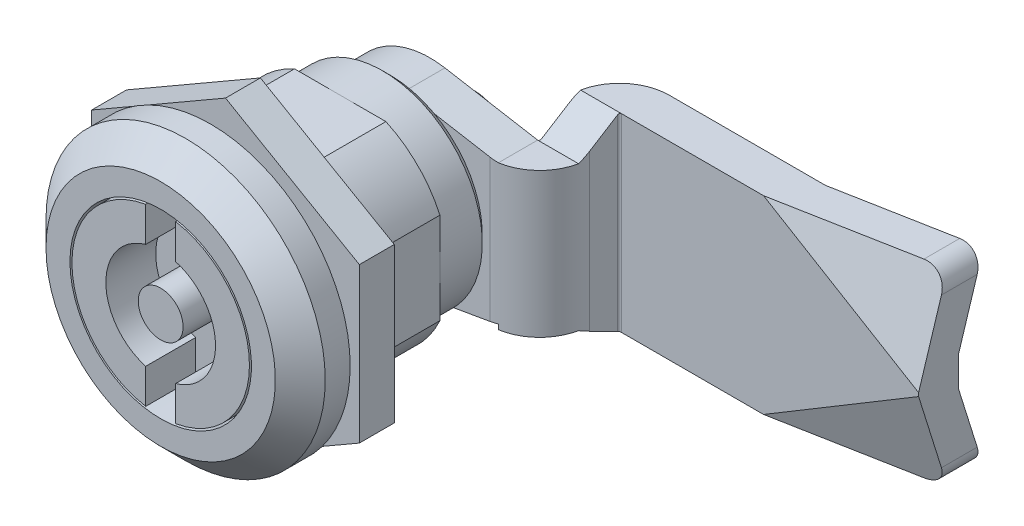
from build123d import *
from OCP.BRepFilletAPI import BRepFilletAPI_MakeChamfer

# Parameters (mm, degrees)
SKETCH1_R           = 14
EXTRUDE1_DEPTH      = 5
EXTRUDE2_DEPTH      = 18
SKETCH7_R           = 11.1
EXTRUDE6_DEPTH      = 3.5
SKETCH6_R           = 2.25
EXTRUDE5_DEPTH      = 5
EXTRUDE9_DEPTH      = 9.5
FILLET1_R           = 8
FILLET2_R           = 3
CUT_EXTRUDE1_DEPTH  = 4
CUT_EXTRUDE2_DEPTH  = 5
SKETCH17_W          = 6.5
SKETCH17_H          = 19
BOSS_EXTRUDE1_DEPTH = 15
CUT_EXTRUDE4_DEPTH  = 2.5
CUT_EXTRUDE8_DEPTH  = 71.458321013
CUT_EXTRUDE9_DEPTH  = 71.458321013
FILLET3_R           = 2
BOSS_EXTRUDE3_DEPTH = 4.5
SKETCH28_R          = 3.4
CUT_EXTRUDE11_DEPTH = 0.1
SKETCH29_W          = 10
SKETCH29_H          = 0.8
CUT_EXTRUDE12_DEPTH = 0.35
CUT_EXTRUDE13_DEPTH = 3
CHAMFER2_SIZE       = 2.68
CHAMFER2_SIZE2      = 1.547298721
FILLET8_R           = 0.6
FILLET9_R           = 0.5
SKETCH32_W          = 0.2
SKETCH32_H          = 5


with BuildPart() as part:
    # Sketch1 → Extrude1 (new body)
    with BuildSketch(Plane.XY):
        Circle(SKETCH1_R)
    extrude(amount=-EXTRUDE1_DEPTH)

    # Sketch2 → Extrude2 (add)
    with BuildSketch(Plane(origin=(0, 0, -5), x_dir=(-1, 0, 0), z_dir=(0, 0, -1))):
        with BuildLine():
            Line((4.582575695, -10), (-4.582575695, -10))
            ThreePointArc((-4.582575695, -10), (-7.778174593, -7.778174593), (-10, -4.582575695))
            Line((-10, -4.582575695), (-10, 4.582575695))
            ThreePointArc((-10, 4.582575695), (-7.778174593, 7.778174593), (-4.582575695, 10))
            Line((-4.582575695, 10), (4.582575695, 10))
            ThreePointArc((4.582575695, 10), (7.778174593, 7.778174593), (10, 4.582575695))
            Line((10, 4.582575695), (10, -4.582575695))
            ThreePointArc((10, -4.582575695), (7.778174593, -7.778174593), (4.582575695, -10))
        make_face()
    extrude(amount=EXTRUDE2_DEPTH)

    # Sketch10 → Cut-Revolve1 (revolve, cut)
    with BuildSketch(Plane(origin=(0, 0, 0), x_dir=(0, 0, -1), z_dir=(1, 0, 0)), mode=Mode.PRIVATE) as cut_revolve1_sk:
        Polygon((0, 11.5), (0, 14), (2.5, 14), align=None)
    revolve(cut_revolve1_sk.sketch.rotate(Axis((0, 0, -5), (0, 0, 1)), 270), axis=Axis((0, 0, -5), (0, 0, 1)), mode=Mode.SUBTRACT)

    # Sketch6 → Extrude5 (cut)
    with BuildSketch(Plane.XY):
        with BuildLine():
            ThreePointArc((1.5, 8.874119675), (0, 9), (-1.5, 8.874119675))
            Line((-1.5, 8.874119675), (-1.5, 5.291502622))
            ThreePointArc((-1.5, 5.291502622), (-5.5, 0), (-1.5, -5.291502622))
            Line((-1.5, -5.291502622), (-1.5, -8.874119675))
            ThreePointArc((-1.5, -8.874119675), (0, -9), (1.5, -8.874119675))
            Line((1.5, -8.874119675), (1.5, -5.291502622))
            ThreePointArc((1.5, -5.291502622), (5.5, 0), (1.5, 5.291502622))
            Line((1.5, 5.291502622), (1.5, 8.874119675))
        make_face()
        Circle(SKETCH6_R, mode=Mode.SUBTRACT)
    extrude(amount=-EXTRUDE5_DEPTH, mode=Mode.SUBTRACT)

    # Sketch32 → Cut-Revolve5 (revolve, cut)
    with BuildSketch(Plane(origin=(0, 0, 0), x_dir=(1, 0, 0), z_dir=(0, 1, 0)), mode=Mode.PRIVATE) as cut_revolve5_sk:
        with Locations((9, 2.5)):
            Rectangle(SKETCH32_W, SKETCH32_H)
    revolve(cut_revolve5_sk.sketch.rotate(Axis((0, 0, -5), (0, 0, 1)), 354.215566928), axis=Axis((0, 0, -5), (0, 0, 1)), mode=Mode.SUBTRACT)

    # Sketch37 → Cut-Revolve7 (revolve, cut)
    with BuildSketch(Plane(origin=(0, 0, 0), x_dir=(0.7071067811865477, -0.7071067811865475, 0), z_dir=(0.7071067811865475, 0.7071067811865477, 0)), mode=Mode.PRIVATE) as cut_revolve7_sk:
        Polygon((-11, 23), (-11, 18), (-10, 18), (-10, 22.25), (-9.25, 23), align=None)
    revolve(cut_revolve7_sk.sketch.rotate(Axis((0, 0, -5), (0, 0, 1)), 45), axis=Axis((0, 0, -5), (0, 0, 1)), mode=Mode.SUBTRACT)


with BuildPart() as body_2:
    # Sketch7 → Extrude6 (new body)
    with BuildSketch(Plane(origin=(0, 0, -6.5), x_dir=(-1, 0, 0), z_dir=(0, 0, -1))):
        Polygon((0, 15.5), (-13.423393759, 7.75), (-13.423393759, -7.75), (0, -15.5), (13.423393759, -7.75), (13.423393759, 7.75), align=None)
        Circle(SKETCH7_R, mode=Mode.SUBTRACT)
    extrude(amount=EXTRUDE6_DEPTH)


with BuildPart() as body_3:
    # Sketch11 → Extrude9 (new, symmetric)
    with BuildSketch(Plane(origin=(0, 0, 0), x_dir=(1, 0, 0), z_dir=(0, 1, 0))):
        with BuildLine():
            Line((-10, 23), (10, 23))
            ThreePointArc((10, 23), (13.535533906, 24.464466094), (15, 28))
            Line((15, 28), (15, 30.8))
            ThreePointArc((15, 30.8), (15.058578644, 30.941421356), (15.2, 31))
            Line((15.2, 31), (45, 31))
            Line((45, 31), (45, 35))
            Line((45, 35), (16, 35))
            ThreePointArc((16, 35), (12.464466094, 33.535533906), (11, 30))
            Line((11, 30), (11, 27.2))
            ThreePointArc((11, 27.2), (10.941421356, 27.058578644), (10.8, 27))
            Line((10.8, 27), (-10, 27))
            Line((-10, 27), (-10, 23))
        make_face()
    extrude(amount=EXTRUDE9_DEPTH, both=True)

    # Fillet1
    fillet1_edges = [body_3.edges().sort_by_distance(p)[0] for p in [
        (-10, -9.5, -25),
        (-10, 9.5, -25),
    ]]
    fillet(fillet1_edges, radius=FILLET1_R)

    # Fillet2
    fillet2_edges = [body_3.edges().sort_by_distance(p)[0] for p in [
        (45, -9.5, -33),
        (45, 9.5, -33),
    ]]
    fillet(fillet2_edges, radius=FILLET2_R)

    # Sketch12 → Cut-Extrude1 (cut)
    with BuildSketch(Plane(origin=(0, 0, -27), x_dir=(-1, 0, 0), z_dir=(0, 0, -1))):
        with BuildLine():
            Line((-10.8, 7), (-1.502005111, 8.620120686))
            ThreePointArc((-1.502005111, 8.620120686), (8.75, 0), (-1.502005111, -8.620120686))
            Line((-1.502005111, -8.620120686), (-10.8, -7))
            Line((-10.8, -7), (-10.8, -10.5))
            Line((-10.8, -10.5), (10.2, -10.5))
            Line((10.2, -10.5), (10.2, 10.5))
            Line((10.2, 10.5), (-10.8, 10.5))
            Line((-10.8, 10.5), (-10.8, 7))
        make_face()
    extrude(amount=-CUT_EXTRUDE1_DEPTH, mode=Mode.SUBTRACT)

    # Sketch14 → Cut-Extrude2 (cut)
    with BuildSketch(Plane.ZY.offset(-10.8)):
        Polygon((-31, 9.5), (-23, 9.5), (-23, 7), (-27, 7), align=None)
        Polygon((-31, -9.5), (-23, -9.5), (-23, -7.5), (-27, -7.5), align=None)
    extrude(amount=-CUT_EXTRUDE2_DEPTH, mode=Mode.SUBTRACT)

    # Sketch17 → Boss-Extrude1 (add)
    with BuildSketch(Plane(origin=(45, 0, 0), x_dir=(0, 0, -1), z_dir=(1, 0, 0))):
        with Locations((34.25, 0)):
            Rectangle(SKETCH17_W, SKETCH17_H)
    extrude(amount=-BOSS_EXTRUDE1_DEPTH)

    # Sketch18 → Cut-Extrude4 (cut)
    with BuildSketch(Plane(origin=(0, 0, -37.5), x_dir=(-1, 0, 0), z_dir=(0, 0, -1))):
        Polygon((-30, 9.5), (-30, -9.5), (-45, -1.5), (-45, 1.5), align=None)
    extrude(amount=-CUT_EXTRUDE4_DEPTH, mode=Mode.SUBTRACT)

    # Sketch20 → Cut-Extrude8 (cut, through all)
    with BuildSketch(Plane(origin=(33.75, 20.25, 0), x_dir=(0, 0, -1), z_dir=(0.8574929257125434, 0.5144957554275278, 0))):
        Polygon((35, -23.581055457), (37.5, -23.581055457), (37.5, -24.438548383), (37.5, -31.298491789), (35, -24.438548383), align=None)
        Polygon((31, -31.298491789), (33.915475947, -31.298491789), (31, -23.298491789), align=None)
    extrude(amount=-CUT_EXTRUDE8_DEPTH, mode=Mode.SUBTRACT)

    # Sketch21 → Cut-Extrude9 (cut, through all)
    with BuildSketch(Plane(origin=(33.75, -20.25, 0), x_dir=(0, 0, -1), z_dir=(0.8574929257125433, -0.5144957554275279, 0))):
        Polygon((31, 31.298491789), (31, 23.298491789), (33.915475947, 31.298491789), align=None)
        Polygon((37.5, 23.581055457), (35, 23.581055457), (35, 24.438548383), (37.5, 31.298491789), align=None)
    extrude(amount=-CUT_EXTRUDE9_DEPTH, mode=Mode.SUBTRACT)

    # Fillet3
    fillet3_edges = [body_3.edges().sort_by_distance(p)[0] for p in [
        (45, 9.5, -35.707737974),
        (45, -9.5, -35.707737974),
    ]]
    fillet(fillet3_edges, radius=FILLET3_R)

    # Sketch23 → Revolve1 (revolve)
    with BuildSketch(Plane(origin=(0, 0, 0), x_dir=(1, 0, 0), z_dir=(0, 1, 0)), mode=Mode.PRIVATE) as revolve1_sk:
        Polygon((0, 27), (0, 30), (-3, 30), (-5.5, 27.5), (-5.5, 27), align=None)
    revolve(revolve1_sk.sketch.rotate(Axis((0, 0, -27), (0, 0, -1)), 180), axis=Axis((0, 0, -27), (0, 0, -1)))

    # Sketch24 → Boss-Extrude3 (add)
    with BuildSketch(Plane(origin=(0, 0, -27), x_dir=(-1, 0, 0), z_dir=(0, 0, -1))):
        Polygon((4, 2.309401077), (0, 4.618802154), (-4, 2.309401077), (-4, -2.309401077), (0, -4.618802154), (4, -2.309401077), align=None)
    extrude(amount=BOSS_EXTRUDE3_DEPTH)

    # Sketch26 → Cut-Revolve4 (revolve, cut)
    with BuildSketch(Plane(origin=(0, 0, 0), x_dir=(-0.8660254037844386, -0.5000000000000001, 0), z_dir=(-0.5000000000000001, 0.8660254037844386, 0)), mode=Mode.PRIVATE) as cut_revolve4_sk:
        Polygon((4.618802154, -31.5), (3.618802154, -31.5), (4.618802154, -30.5), align=None)
    revolve(cut_revolve4_sk.sketch.rotate(Axis((0, 0, -5), (0, 0, 1)), 119.99999998), axis=Axis((0, 0, -5), (0, 0, 1)), mode=Mode.SUBTRACT)

    # Sketch28 → Cut-Extrude11 (cut)
    with BuildSketch(Plane(origin=(0, 0, -31.5), x_dir=(-1, 0, 0), z_dir=(0, 0, -1))):
        Circle(SKETCH28_R)
    extrude(amount=-CUT_EXTRUDE11_DEPTH, mode=Mode.SUBTRACT)

    # Sketch29 → Cut-Extrude12 (cut)
    with BuildSketch(Plane(origin=(0, 0, -31.5), x_dir=(-1, 0, 0), z_dir=(0, 0, -1))):
        Rectangle(SKETCH29_W, SKETCH29_H)
    extrude(amount=-CUT_EXTRUDE12_DEPTH, mode=Mode.SUBTRACT)

    # Sketch30 → Cut-Extrude13 (cut)
    with BuildSketch(Plane(origin=(0, 0, -31.4), x_dir=(-1, 0, 0), z_dir=(0, 0, -1))):
        Polygon((0.4, 0.4), (2.25, 0.4), (2.25, -0.4), (0.4, -0.4), (0.4, -2.25), (-0.4, -2.25), (-0.4, -0.4), (-2.25, -0.4), (-2.25, 0.4), (-0.4, 0.4), (-0.4, 2.25), (0.4, 2.25), align=None)
    extrude(amount=-CUT_EXTRUDE13_DEPTH, mode=Mode.SUBTRACT)

    # Chamfer2: one chamfer whose edges measure the first distance from different faces: ONE call of the kernel's chamfer builder (chamfer() names one face for all edges)
    chamfer2_edges_1 = [body_3.edges().sort_by_distance(p)[0] for p in [
        (2.25, 0, -28.4),
    ]]
    chamfer2_side_1 = [body_3.faces().sort_by_distance(p)[0] for p in [
        (2.25, 0, -29.775),
    ]]
    chamfer2_edges_2 = [body_3.edges().sort_by_distance(p)[0] for p in [
        (-2.25, 0, -28.4),
    ]]
    chamfer2_side_2 = [body_3.faces().sort_by_distance(p)[0] for p in [
        (-2.25, 0, -29.775),
    ]]
    chamfer2_edges_3 = [body_3.edges().sort_by_distance(p)[0] for p in [
        (0, -2.25, -28.4),
    ]]
    chamfer2_side_3 = [body_3.faces().sort_by_distance(p)[0] for p in [
        (0, -2.25, -29.9),
    ]]
    chamfer2_edges_4 = [body_3.edges().sort_by_distance(p)[0] for p in [
        (0, 2.25, -28.4),
    ]]
    chamfer2_side_4 = [body_3.faces().sort_by_distance(p)[0] for p in [
        (0, 2.25, -29.9),
    ]]
    chamfer2 = BRepFilletAPI_MakeChamfer(body_3.part.solid().wrapped)
    for e in chamfer2_edges_1:
        chamfer2.Add(CHAMFER2_SIZE, CHAMFER2_SIZE2, e.wrapped, chamfer2_side_1[0].wrapped)  # the first distance lies on this face
    for e in chamfer2_edges_2:
        chamfer2.Add(CHAMFER2_SIZE, CHAMFER2_SIZE2, e.wrapped, chamfer2_side_2[0].wrapped)  # the first distance lies on this face
    for e in chamfer2_edges_3:
        chamfer2.Add(CHAMFER2_SIZE, CHAMFER2_SIZE2, e.wrapped, chamfer2_side_3[0].wrapped)  # the first distance lies on this face
    for e in chamfer2_edges_4:
        chamfer2.Add(CHAMFER2_SIZE, CHAMFER2_SIZE2, e.wrapped, chamfer2_side_4[0].wrapped)  # the first distance lies on this face
    add(Compound.cast(chamfer2.Shape()), mode=Mode.REPLACE)

    # Fillet8
    # the kernel refuses this fillet: 0.6 mm, written as the material it takes off along each edge
    with BuildSketch(Plane(origin=(-0.4, -0.4, -28.4), x_dir=(-1, 0, 0), z_dir=(0, 0, -1))) as fillet8_piece_1_section:
        with BuildLine():
            CenterArc((FILLET8_R, -FILLET8_R), FILLET8_R, 90, 90)
            Line((0, -FILLET8_R), (0, 0))
            Line((0, 0), (FILLET8_R, 0))
        make_face()
    fillet8_piece_1 = extrude(amount=4.5, mode=Mode.PRIVATE)
    fillet8_piece_1 = split(fillet8_piece_1, bisect_by=Plane(origin=(-1.643462991, -0.534948733, -30.029447084), z_dir=(0.866025403784438, 0, -0.5000000000000011)), keep=Keep.TOP, mode=Mode.PRIVATE)
    fillet8_piece_1 = split(fillet8_piece_1, bisect_by=Plane(origin=(-0.534948733, -1.643462991, -30.029447084), z_dir=(0, 0.866025403784438, -0.5000000000000011)), keep=Keep.TOP, mode=Mode.PRIVATE)
    add(fillet8_piece_1, mode=Mode.SUBTRACT)
    with BuildSketch(Plane(origin=(0.4, -0.4, -32.9), x_dir=(1, 0, 0), z_dir=(0, 0, 1))) as fillet8_piece_2_section:
        with BuildLine():
            CenterArc((FILLET8_R, -FILLET8_R), FILLET8_R, 90, 90)
            Line((0, -FILLET8_R), (0, 0))
            Line((0, 0), (FILLET8_R, 0))
        make_face()
    fillet8_piece_2 = extrude(amount=4.5, mode=Mode.PRIVATE)
    fillet8_piece_2 = split(fillet8_piece_2, bisect_by=Plane(origin=(1.643462991, -0.534948733, -30.029447084), z_dir=(-0.866025403784438, 0, -0.5000000000000011)), keep=Keep.TOP, mode=Mode.PRIVATE)
    fillet8_piece_2 = split(fillet8_piece_2, bisect_by=Plane(origin=(0.534948733, -1.643462991, -30.029447084), z_dir=(0, 0.866025403784438, -0.5000000000000011)), keep=Keep.TOP, mode=Mode.PRIVATE)
    add(fillet8_piece_2, mode=Mode.SUBTRACT)
    with BuildSketch(Plane(origin=(-0.4, 0.4, -32.9), x_dir=(-1, 0, 0), z_dir=(0, 0, 1))) as fillet8_piece_3_section:
        with BuildLine():
            CenterArc((FILLET8_R, -FILLET8_R), FILLET8_R, 90, 90)
            Line((0, -FILLET8_R), (0, 0))
            Line((0, 0), (FILLET8_R, 0))
        make_face()
    fillet8_piece_3 = extrude(amount=4.5, mode=Mode.PRIVATE)
    fillet8_piece_3 = split(fillet8_piece_3, bisect_by=Plane(origin=(-1.643462991, 0.534948733, -30.029447084), z_dir=(0.866025403784438, 0, -0.5000000000000011)), keep=Keep.TOP, mode=Mode.PRIVATE)
    fillet8_piece_3 = split(fillet8_piece_3, bisect_by=Plane(origin=(-0.534948733, 1.643462991, -30.029447084), z_dir=(0, -0.866025403784438, -0.5000000000000011)), keep=Keep.TOP, mode=Mode.PRIVATE)
    add(fillet8_piece_3, mode=Mode.SUBTRACT)
    with BuildSketch(Plane(origin=(0.4, 0.4, -28.4), x_dir=(1, 0, 0), z_dir=(0, 0, -1))) as fillet8_piece_4_section:
        with BuildLine():
            CenterArc((FILLET8_R, -FILLET8_R), FILLET8_R, 90, 90)
            Line((0, -FILLET8_R), (0, 0))
            Line((0, 0), (FILLET8_R, 0))
        make_face()
    fillet8_piece_4 = extrude(amount=4.5, mode=Mode.PRIVATE)
    fillet8_piece_4 = split(fillet8_piece_4, bisect_by=Plane(origin=(1.643462991, 0.534948733, -30.029447084), z_dir=(-0.866025403784438, 0, -0.5000000000000011)), keep=Keep.TOP, mode=Mode.PRIVATE)
    fillet8_piece_4 = split(fillet8_piece_4, bisect_by=Plane(origin=(0.534948733, 1.643462991, -30.029447084), z_dir=(0, -0.866025403784438, -0.5000000000000011)), keep=Keep.TOP, mode=Mode.PRIVATE)
    add(fillet8_piece_4, mode=Mode.SUBTRACT)

    # Fillet9
    # the kernel refuses this fillet: 0.5 mm, written as the material it takes off along each edge
    with BuildSketch(Plane(origin=(-2.25, 0.4, -31.15), x_dir=(-1, 0, 0), z_dir=(0, -1, 0)), Plane(origin=(2.25, -0.4, -31.15), x_dir=(1, 0, 0), z_dir=(0, 1, 0))) as fillet9_piece_1:
        with BuildLine():
            CenterArc((0.255147016, -0.5), FILLET9_R, 90, 30.68341711)
            Line((0, -0.07), (0, 0))
            Line((0, 0), (0.255147016, 0))
        make_face()
    extrude(amount=0.8, mode=Mode.SUBTRACT)
    with BuildSketch(Plane(origin=(0.4, 2.25, -31.4), x_dir=(0, 1, 0), z_dir=(-1, 0, 0))) as fillet9_piece_2:
        with BuildLine():
            CenterArc((0.466476152, -0.5), FILLET9_R, 90, 68.899803976)
            Line((0, -0.32), (0, 0))
            Line((0, 0), (0.466476152, 0))
        make_face()
    extrude(amount=0.8, mode=Mode.SUBTRACT)
    with BuildSketch(Plane(origin=(-0.4, -2.25, -31.4), x_dir=(0, 0, 1), z_dir=(1, 0, 0))) as fillet9_piece_3:
        with BuildLine():
            CenterArc((0.5, 0.466476152), FILLET9_R, 180, 68.899803976)
            Line((0, 0.466476152), (0, 0))
            Line((0, 0), (0.32, 0))
        make_face()
    extrude(amount=0.8, mode=Mode.SUBTRACT)


solid = Compound([part.part, body_2.part, body_3.part])
